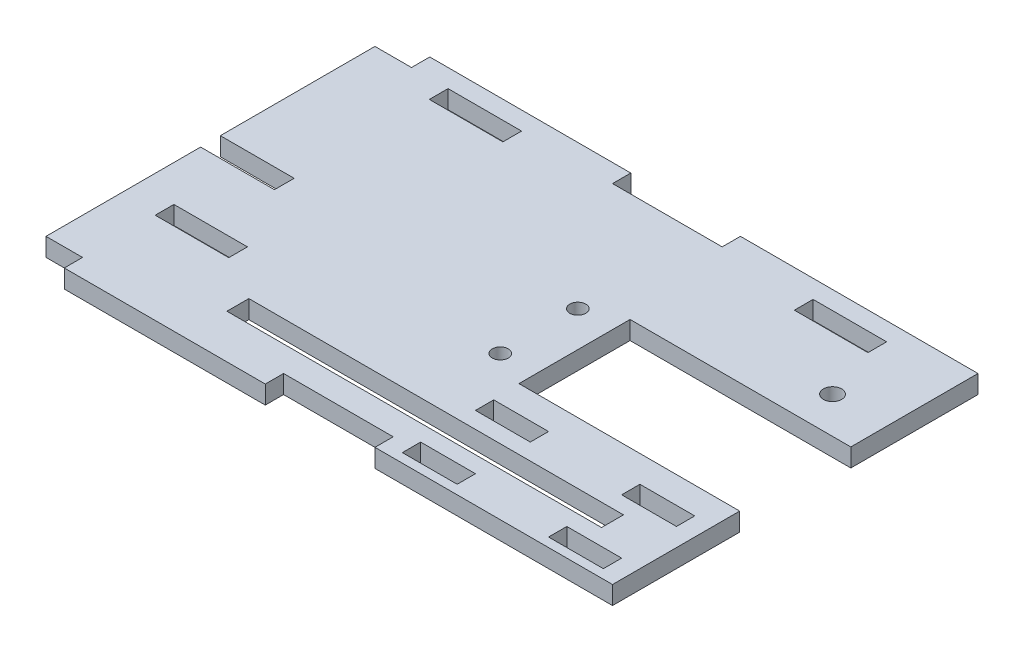
from build123d import *

# Parameters (mm, degrees)
BOSS_EXTRUDE1_DEPTH     = 6.35
SKETCH4_W               = 25.5524
SKETCH4_H               = 6.5024
SKETCH4_W_2             = 12.7
SKETCH4_H_2             = 6.35
SKETCH4_W_3             = 38.1
CUT_EXTRUDE1_DEPTH      = 240.70724332
SKETCH5_R               = 3.175
CUT_EXTRUDE2_DEPTH      = 240.70724332
SKETCH6_R               = 2.778125
CUT_EXTRUDE3_DEPTH      = 240.70724332
SKETCH7_W               = 25.5524
SKETCH7_H               = 6.5024
CUT_EXTRUDE4_DEPTH      = 240.70724332
CUT_EXTRUDE5_DEPTH      = 240.70724332
CUT_EXTRUDE5_DEPTH_BACK = 240.70724332
SKETCH8_W               = 19.05
SKETCH8_H               = 6.35
CUT_EXTRUDE6_DEPTH      = 240.70724332
CUT_EXTRUDE6_DEPTH_BACK = 240.70724332
SKETCH9_W               = 130.175
SKETCH9_H               = 7.62


with BuildPart() as part:
    # Sketch1 → Boss-Extrude1 (new body)
    with BuildSketch(Plane(origin=(0, 0, 0), x_dir=(1, 0, 0), z_dir=(0, 1, 0))):
        Polygon((0, 60.071), (0, 0), (203.2, 0), (203.2, 44.196), (126.492, 44.196), (126.492, 82.804), (203.2, 82.804), (203.2, 127), (0, 127), (0, 66.929), (25.654, 66.929), (25.654, 60.071), align=None)
    extrude(amount=BOSS_EXTRUDE1_DEPTH)

    # Sketch4 → Cut-Extrude1 (cut, through all)
    with BuildSketch(Plane(origin=(0, 6.35, 0), x_dir=(1, 0, 0), z_dir=(0, 1, 0))):
        with Locations((38.1762, 117.3988)):
            Rectangle(SKETCH4_W, SKETCH4_H)
        with Locations((165.0238, 117.3988)):
            Rectangle(SKETCH4_W, SKETCH4_H)
        with Locations((6.35, 123.825)):
            Rectangle(SKETCH4_W_2, SKETCH4_H_2)
        with Locations((6.35, 3.175)):
            Rectangle(SKETCH4_W_2, SKETCH4_H_2)
        with Locations((101.6, 3.175)):
            Rectangle(SKETCH4_W_3, SKETCH4_H_2)
        with Locations((101.6, 123.825)):
            Rectangle(SKETCH4_W_3, SKETCH4_H_2)
    extrude(amount=-CUT_EXTRUDE1_DEPTH, mode=Mode.SUBTRACT)

    # Sketch5 → Cut-Extrude2 (cut, through all)
    with BuildSketch(Plane(origin=(0, 6.35, 0), x_dir=(1, 0, 0), z_dir=(0, 1, 0))):
        with Locations((184.15, 95.504)):
            Circle(SKETCH5_R)
    extrude(amount=-CUT_EXTRUDE2_DEPTH, mode=Mode.SUBTRACT)

    # Sketch6 → Cut-Extrude3 (cut, through all)
    with BuildSketch(Plane.XZ):
        with Locations((114.173, -50.038)):
            Circle(SKETCH6_R)
        with Locations((114.173, -76.962)):
            Circle(SKETCH6_R)
    extrude(amount=-CUT_EXTRUDE3_DEPTH, mode=Mode.SUBTRACT)

    # Sketch7 → Cut-Extrude4 (cut, through all)
    with BuildSketch(Plane(origin=(0, 6.35, 0), x_dir=(1, 0, 0), z_dir=(0, 1, 0))):
        with Locations((25.4, 34.925)):
            Rectangle(SKETCH7_W, SKETCH7_H)
    extrude(amount=-CUT_EXTRUDE4_DEPTH, mode=Mode.SUBTRACT)

    # Sketch8 → Cut-Extrude5 (cut, two sides: drawn at the far end of the back side and taken through both)
    with BuildSketch(Plane.XZ.offset(-CUT_EXTRUDE5_DEPTH_BACK)):
        with Locations((187.325, -6.35)):
            Rectangle(SKETCH8_W, SKETCH8_H)
        with Locations((187.325, -31.75)):
            Rectangle(SKETCH8_W, SKETCH8_H)
        with Locations((136.525, -31.75)):
            Rectangle(SKETCH8_W, SKETCH8_H)
        with Locations((136.525, -6.35)):
            Rectangle(SKETCH8_W, SKETCH8_H)
    extrude(amount=CUT_EXTRUDE5_DEPTH + CUT_EXTRUDE5_DEPTH_BACK, mode=Mode.SUBTRACT)

    # Sketch9 → Cut-Extrude6 (cut, two sides: drawn at the far end of the back side and taken through both)
    with BuildSketch(Plane.XZ.offset(-CUT_EXTRUDE6_DEPTH_BACK)):
        with Locations((119.0625, -19.05)):
            Rectangle(SKETCH9_W, SKETCH9_H)
    extrude(amount=CUT_EXTRUDE6_DEPTH + CUT_EXTRUDE6_DEPTH_BACK, mode=Mode.SUBTRACT)


solid = part.part
